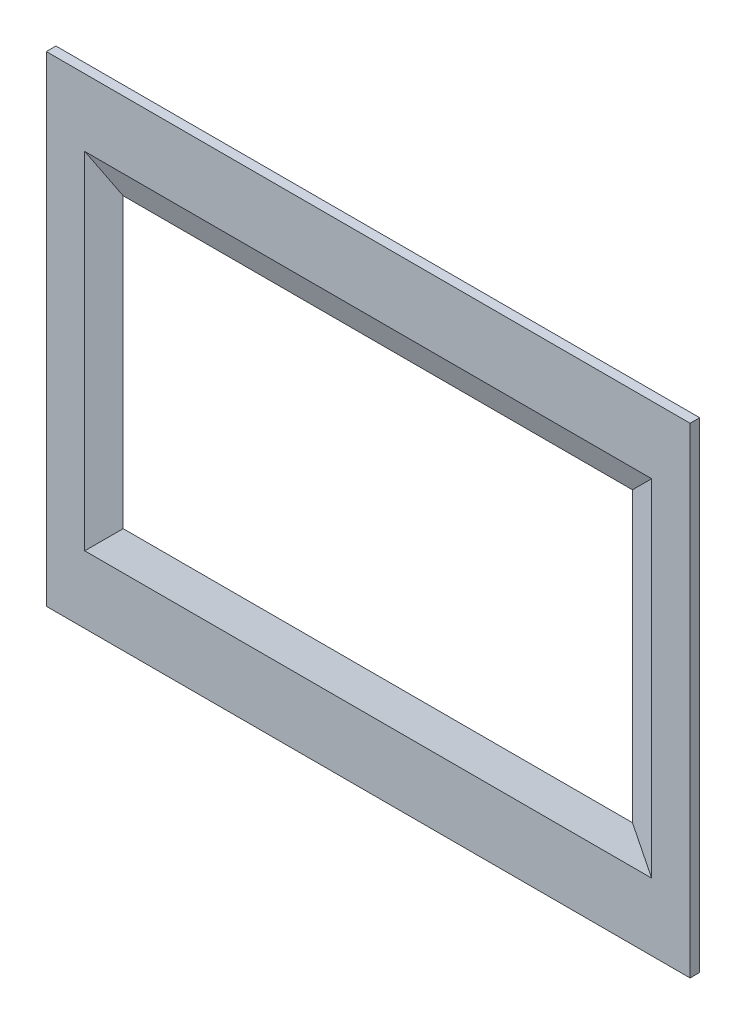
from build123d import *

# Parameters (mm, degrees)
SKETCH1_W      = 670
SKETCH1_H      = 500
SKETCH1_W_2    = 530
SKETCH1_H_2    = 300
EXTRUDE1_DEPTH = 10
CHAMFER1_SIZE2 = 30
CHAMFER1_SIZE  = 10
CHAMFER2_SIZE2 = 10
CHAMFER2_SIZE  = 30
CHAMFER3_SIZE2 = 30
CHAMFER3_SIZE  = 10
CHAMFER4_SIZE2 = 10
CHAMFER4_SIZE  = 30


with BuildPart() as part:
    # Sketch1 → Extrude1 (new body)
    with BuildSketch(Plane.XY):
        with Locations((335, 250)):
            Rectangle(SKETCH1_W, SKETCH1_H)
        with Locations((335, 250)):
            Rectangle(SKETCH1_W_2, SKETCH1_H_2, mode=Mode.SUBTRACT)
    extrude(amount=EXTRUDE1_DEPTH)

    # Chamfer1
    chamfer1_edges = [part.edges().sort_by_distance(p)[0] for p in [
        (335, 400, 10),
    ]]
    chamfer1_side = [part.faces().sort_by_distance(p)[0] for p in [
        (335, 400, 9.8),
    ]]
    chamfer(chamfer1_edges, length=CHAMFER1_SIZE - 0.0001, length2=CHAMFER1_SIZE2 - 0.0001, reference=chamfer1_side[0])  # a hair under: the kernel refuses the full size

    # Chamfer2
    chamfer2_edges = [part.edges().sort_by_distance(p)[0] for p in [
        (70, 264.99995, 10),
    ]]
    chamfer2_side = [part.faces().sort_by_distance(p)[0] for p in [
        (69.8, 264.99995, 10),
    ]]
    chamfer(chamfer2_edges, length=CHAMFER2_SIZE - 0.0001, length2=CHAMFER2_SIZE2 - 0.0001, reference=chamfer2_side[0])  # a hair under: the kernel refuses the full size

    # Chamfer3
    chamfer3_edges = [part.edges().sort_by_distance(p)[0] for p in [
        (320.00005, 100, 10),
    ]]
    chamfer3_side = [part.faces().sort_by_distance(p)[0] for p in [
        (320.00005, 100, 9.8),
    ]]
    chamfer(chamfer3_edges, length=CHAMFER3_SIZE - 0.0001, length2=CHAMFER3_SIZE2 - 0.0001, reference=chamfer3_side[0])  # a hair under: the kernel refuses the full size

    # Chamfer4
    chamfer4_edges = [part.edges().sort_by_distance(p)[0] for p in [
        (600, 250, 10),
    ]]
    chamfer4_side = [part.faces().sort_by_distance(p)[0] for p in [
        (600.2, 250, 10),
    ]]
    chamfer(chamfer4_edges, length=CHAMFER4_SIZE - 0.0001, length2=CHAMFER4_SIZE2 - 0.0001, reference=chamfer4_side[0])  # a hair under: the kernel refuses the full size


solid = part.part
